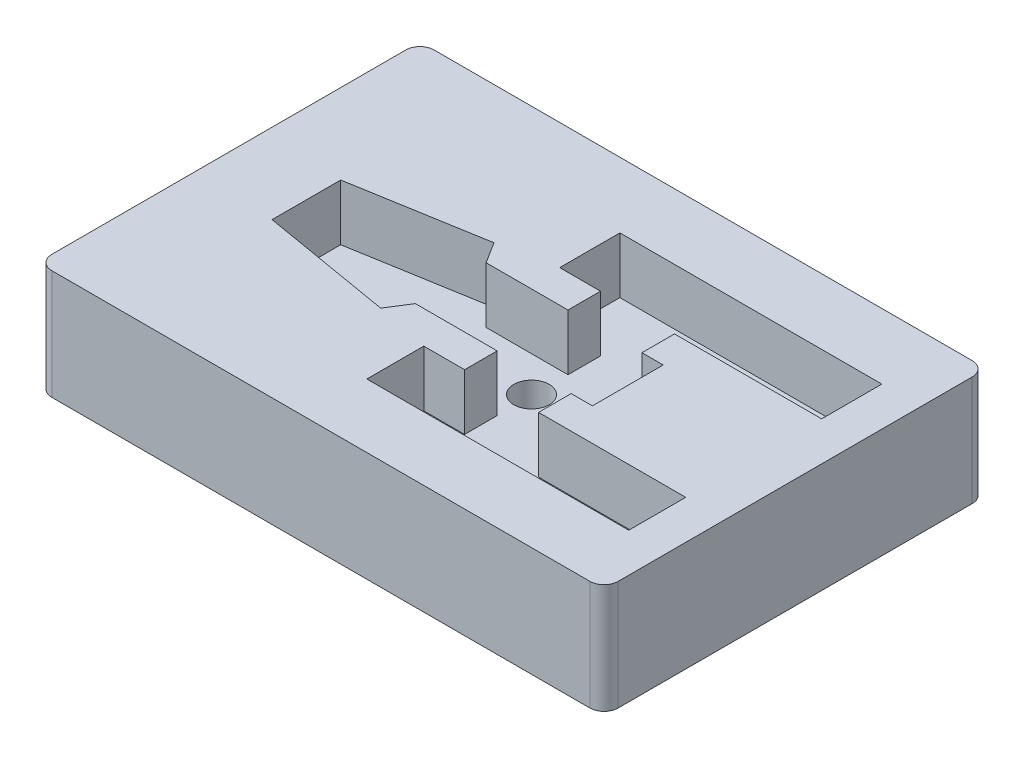
from build123d import *

# Parameters (mm, degrees)
SKETCH1_W           = 80
SKETCH1_H           = 54
BOSS_EXTRUDE2_DEPTH = 15.5
FILLET1_R           = 2
Y_WING_START        = -26.76167351
Y_WING_DEPTH        = 8
Y_WING_START_2      = -32.76167351
Y_WING_2_OUTLINE_R  = 2.5
Y_WING_2_DEPTH      = 6


with BuildPart() as part:
    # Sketch1 → Boss-Extrude2 (new body)
    with BuildSketch(Plane(origin=(0, 0, 0), x_dir=(1, 0, 0), z_dir=(0, 1, 0))):
        with Locations((40, 27)):
            Rectangle(SKETCH1_W, SKETCH1_H)
    extrude(amount=BOSS_EXTRUDE2_DEPTH)

    # Fillet1
    fillet1_edges = [part.edges().sort_by_distance(p)[0] for p in [
        (0, 7.75, -54),
        (80, 7.75, -54),
        (80, 7.75, 0),
        (0, 7.75, 0),
    ]]
    fillet(fillet1_edges, radius=FILLET1_R)


with BuildPart() as body_2:
    # Y-Wing: read off the stored shape, not the designer's step
    # Y-Wing outline → Y-Wing (new body)
    with BuildSketch(Plane(origin=(0, 0, 0), x_dir=(1, 0, 0), z_dir=(0, 1, 0)).offset(Y_WING_START)):
        Polygon((-37.998848216, 80.77793428), (-49.561243891, 80.77793428), (-51.452110178, 83.77793428), (-69.950345376, 80.625586413), (-69.950345376, 70.93293428), (-51.452110178, 67.77793428), (-49.561243891, 70.77793428), (-37.998848216, 70.77793428), (-37.998848216, 66.17793428), (-43.764531914, 66.17793428), (-43.764531914, 58.130000785), (-6.764531914, 58.130000785), (-6.764531914, 66.17793428), (-27.548546514, 66.17793428), (-27.548546514, 70.77793428), (-24.545586254, 70.77793428), (-24.545586254, 80.77793428), (-27.548546514, 80.77793428), (-27.548546514, 85.37793428), (-6.764531914, 85.37793428), (-6.764531914, 93.87793428), (-43.764531914, 93.87793428), (-43.764531914, 85.37793428), (-37.998848216, 85.37793428), align=None)
    extrude(amount=Y_WING_DEPTH)

    # Y-Wing 2 outline → Y-Wing 2 (add)
    with BuildSketch(Plane(origin=(0, 0, 0), x_dir=(1, 0, 0), z_dir=(0, 1, 0)).offset(Y_WING_START_2)):
        with Locations((-38.150345376, 75.778331613)):
            Circle(Y_WING_2_OUTLINE_R)
    extrude(amount=Y_WING_2_DEPTH)


with BuildPart() as body_2_1:
    # Body-Move/Copy3: moved
    add(body_2.part.moved(Location((81.260162004, 34.341820547, 49.133266847))))


with BuildPart() as part_1:
    add(part.part)

    # Intersect1: read off the stored shape, not the designer's step
    # Intersect1: cut body 2
    add(body_2_1.part, mode=Mode.SUBTRACT)


solid = part_1.part
